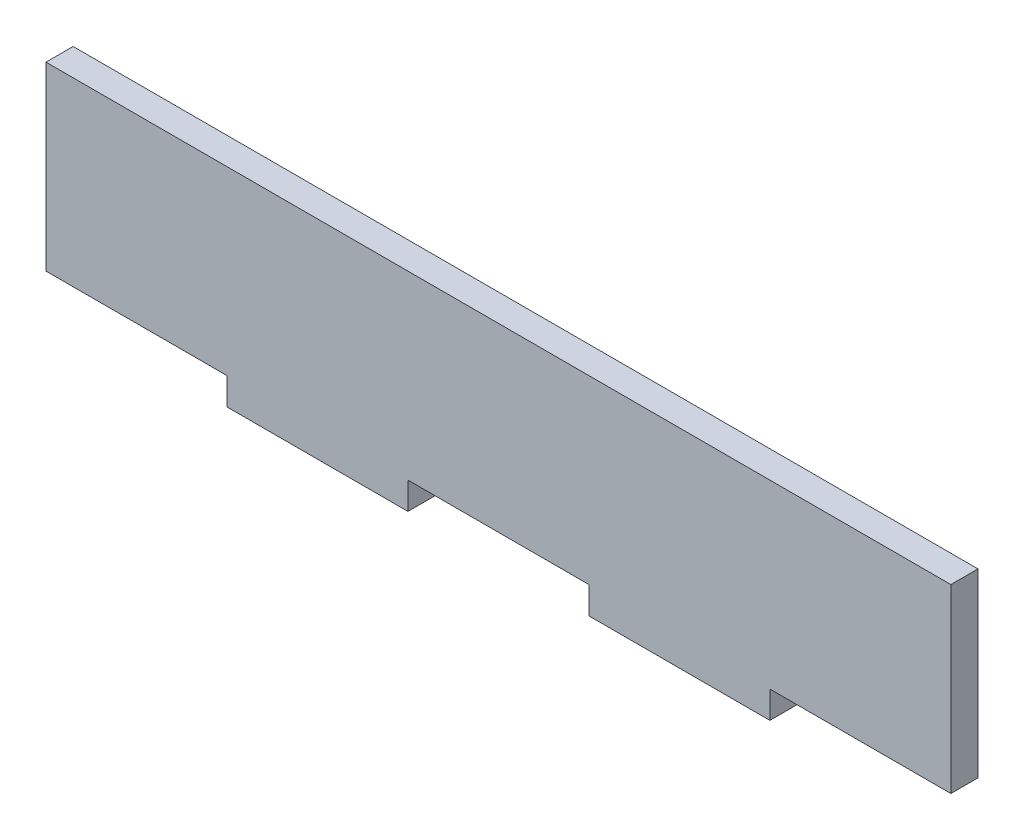
from build123d import *

# Parameters (mm, degrees)
SKETCH1_W           = 200
SKETCH1_H           = 46
BOSS_EXTRUDE1_DEPTH = 6
SKETCH2_W           = 40
SKETCH2_H           = 6
CUT_EXTRUDE1_DEPTH  = 6


with BuildPart() as part:
    # Sketch1 → Boss-Extrude1 (new body)
    with BuildSketch(Plane.XY):
        Rectangle(SKETCH1_W, SKETCH1_H)
    extrude(amount=BOSS_EXTRUDE1_DEPTH)

    # Sketch2 → Cut-Extrude1 (cut)
    with BuildSketch(Plane.XY.offset(6)):
        with Locations((0, -20)):
            Rectangle(SKETCH2_W, SKETCH2_H)
        with Locations((-80, -20)):
            Rectangle(SKETCH2_W, SKETCH2_H)
        with Locations((80, -20)):
            Rectangle(SKETCH2_W, SKETCH2_H)
    extrude(amount=-CUT_EXTRUDE1_DEPTH, mode=Mode.SUBTRACT)


solid = part.part
